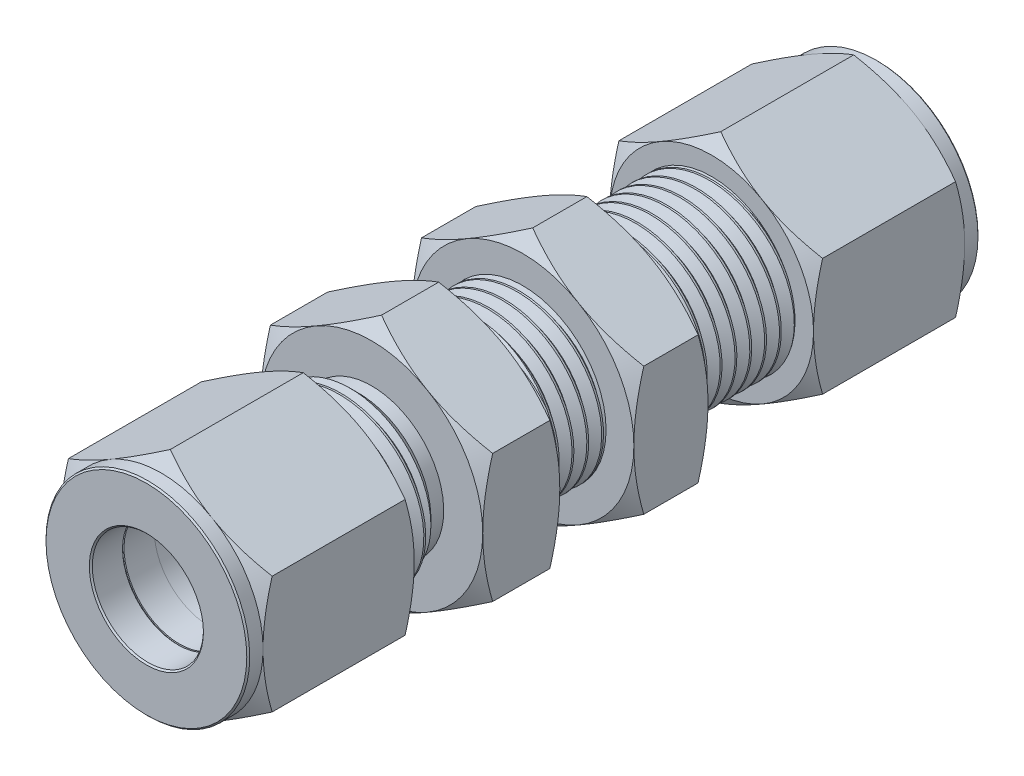
from build123d import *

# Parameters (mm, degrees)
BOSS_EXTRUDE1_DEPTH = 14.224
CHAMFER1_SIZE       = 0.127
SKETCH4_W           = 47.8155
SKETCH4_H           = 7.14375
CUT_SWEEP1_PITCH    = 1.27
CUT_SWEEP1_FROM     = 0
BOSS_EXTRUDE2_DEPTH = 6.604
CIRPATTERN1_COUNT   = 2
SKETCH11_R          = 7.14375
BOSS_EXTRUDE3_DEPTH = 6.35


with BuildPart() as part:
    # Sketch2 → Boss-Extrude1 (new body)
    with BuildSketch(Plane.XY):
        Polygon((0, 10.081979076), (-8.73125, 5.040989538), (-8.73125, -5.040989538), (0, -10.081979076), (8.73125, -5.040989538), (8.73125, 5.040989538), align=None)
    extrude(amount=-BOSS_EXTRUDE1_DEPTH)

    # Sketch3 → Cut-Revolve1 (revolve, cut)
    with BuildSketch(Plane(origin=(0, 0, 0), x_dir=(0, 0, -1), z_dir=(1, 0, 0)), mode=Mode.PRIVATE) as cut_revolve1_sk:
        Polygon((0, 10.081979076), (0, 8.73125), (1.27, 8.73125), (2.049843795, 10.081979076), (13.444156205, 10.081979076), (14.224, 8.73125), (14.224, 10.081979076), (14.224, 11.432708151), (0, 11.432708151), align=None)
        Polygon((0, 4.7625), (0, 0), (14.224, 0), (14.224, 7.14375), (5.6896, 7.14375), (5.6896, 6.50875), (2.8448, 6.50875), (2.8448, 5.87375), (2.8448, 4.7625), align=None)
    revolve(cut_revolve1_sk.sketch.rotate(Axis((0, 0, 0), (0, 0, -1)), 180), axis=Axis((0, 0, 0), (0, 0, -1)), mode=Mode.SUBTRACT)

    # Chamfer1
    chamfer1_edges = [part.edges().sort_by_distance(p)[0] for p in [
        (0, 8.73125, 0),
        (0, 4.7625, -2.8448),
        (0, 4.7625, 0),
    ]]
    chamfer(chamfer1_edges, length=CHAMFER1_SIZE)


with BuildPart() as body_2:
    # Sketch4 → Revolve1 (revolve)
    with BuildSketch(Plane(origin=(0, 0, 0), x_dir=(0, 0, -1), z_dir=(1, 0, 0))):
        with Locations((31.33725, 3.571875)):
            Rectangle(SKETCH4_W, SKETCH4_H)
    revolve(axis=Axis((0, 0, -55.245), (0, 0, 1)))

    # Cut-Sweep1: arcs per turn and ends read off the stored shape
    # Cut-Sweep1: the profile of Sketch6 screwed along a right-hand helix through 46.016197 turns, 8 arcs to a turn; built about Z, then put on its axis
    cut_sweep1_z = Axis((0, 0, 0), (0, 0, 1))
    cut_sweep1_corners = [(6.318860803, 0, -1.905), (7.212490766, 0, -2.4209375), (7.212490766, 0, -1.2303125), (6.318860803, 0, -1.74625)]
    with BuildLine(mode=Mode.PRIVATE) as cut_sweep1_profile:
        Line(cut_sweep1_corners[0], cut_sweep1_corners[1])
        Line(cut_sweep1_corners[1], cut_sweep1_corners[2])
        Line(cut_sweep1_corners[2], cut_sweep1_corners[3])
        Line(cut_sweep1_corners[3], cut_sweep1_corners[0])
    cut_sweep1_cap = Face(cut_sweep1_profile.wire())
    cut_sweep1_turn_angles = [0, 22.5, 45, 67.5, 90, 112.5, 135, 157.5, 180, 202.5, 225, 247.5, 270, 292.5, 315, 337.5, 360]
    cut_sweep1_turn_weights = [1, 0.9238795325112867, 1, 0.9238795325112867, 1, 0.9238795325112867, 1, 0.9238795325112867, 1, 0.9238795325112867, 1, 0.9238795325112867, 1, 0.9238795325112867, 1, 0.9238795325112867, 1]
    cut_sweep1_turn_rails = [Edge.make_bspline([Vector(p[0], p[1], 0).rotate(cut_sweep1_z, cut_sweep1_turn_angles[k]) / cut_sweep1_turn_weights[k] + Vector(0, 0, p[2] + CUT_SWEEP1_PITCH * cut_sweep1_turn_angles[k] / 360) for k in range(17)], [0, 0, 0, 1, 1, 2, 2, 3, 3, 4, 4, 5, 5, 6, 6, 7, 7, 8, 8, 8], 2, cut_sweep1_turn_weights) for p in cut_sweep1_corners]
    cut_sweep1_turn_sides = [Face.make_surface_from_curves(cut_sweep1_turn_rails[p[0]], cut_sweep1_turn_rails[p[1]]) for p in [(0, 1), (1, 2), (2, 3), (3, 0)]]
    cut_sweep1_last_angles = [16560, 16562.9155, 16565.831]
    cut_sweep1_last_weights = [1, 0.9987056339316177, 1]
    cut_sweep1_last_rails = [Edge.make_bspline([Vector(p[0], p[1], 0).rotate(cut_sweep1_z, cut_sweep1_last_angles[k]) / cut_sweep1_last_weights[k] + Vector(0, 0, p[2] + CUT_SWEEP1_PITCH * cut_sweep1_last_angles[k] / 360) for k in range(3)], [0, 0, 0, 1, 1, 1], 2, cut_sweep1_last_weights) for p in cut_sweep1_corners]
    cut_sweep1_last_sides = [Face.make_surface_from_curves(cut_sweep1_last_rails[p[0]], cut_sweep1_last_rails[p[1]]) for p in [(0, 1), (1, 2), (2, 3), (3, 0)]]
    cut_sweep1 = Plane(origin=(0, 0, -7.4295), x_dir=(0, 1, 0), z_dir=(0, 0, -1)) * split(Solid(Shell([*[p.moved(Location((0, 0, CUT_SWEEP1_PITCH * i))) for i in range(46) for p in cut_sweep1_turn_sides], *cut_sweep1_last_sides, cut_sweep1_cap, cut_sweep1_cap.rotate(cut_sweep1_z, 16565.831).moved(Location((0, 0, CUT_SWEEP1_PITCH * 16565.831 / 360)))])), bisect_by=Plane.XY.offset(CUT_SWEEP1_FROM), keep=Keep.TOP, mode=Mode.PRIVATE)
    add(cut_sweep1, mode=Mode.SUBTRACT)

    # Sketch7 → Boss-Extrude2 (add)
    with BuildSketch(Plane.XY.offset(-25.908)):
        Polygon((0, 10.998522628), (-9.525, 5.499261314), (-9.525, -5.499261314), (0, -10.998522628), (9.525, -5.499261314), (9.525, 5.499261314), align=None)
    extrude(amount=BOSS_EXTRUDE2_DEPTH)

    # Sketch8 → Cut-Revolve2 (revolve, cut)
    with BuildSketch(Plane(origin=(0, 0, 0), x_dir=(0, 0, -1), z_dir=(1, 0, 0)), mode=Mode.PRIVATE) as cut_revolve2_sk:
        Polygon((7.4295, 7.281231533), (7.4295, 6.18137927), (8.529352263, 7.281231533), align=None)
        Polygon((19.304, 7.281231533), (17.104295474, 7.281231533), (18.204147737, 6.18137927), (19.304, 6.18137927), align=None)
        Polygon((19.304, 9.525), (20.154738686, 10.998522628), (25.057261314, 10.998522628), (25.908, 9.525), (25.908, 10.998522628), (25.908, 12.472045256), (19.304, 12.472045256), (19.304, 10.998522628), align=None)
        Polygon((17.018, 3.5687), (45.6565, 3.5687), (45.6565, 4.7625), (51.751831579, 4.7625), (55.245, 5.626695313), (55.245, 0), (7.4295, 0), (7.4295, 5.626695312), (10.922668421, 4.7625), (17.018, 4.7625), align=None)
        Polygon((54.145147737, 7.281231533), (55.245, 7.281231533), (55.245, 6.18137927), align=None)
        Polygon((25.908, 6.18137927), (25.908, 7.281231533), (28.107704526, 7.281231533), (27.007852263, 6.18137927), align=None)
    revolve(cut_revolve2_sk.sketch.rotate(Axis((0, 0, 0), (0, 0, -1)), 90), axis=Axis((0, 0, 0), (0, 0, -1)), mode=Mode.SUBTRACT)


with BuildPart() as body_3:
    # Sketch9 → Revolve2 (revolve)
    with BuildSketch(Plane(origin=(0, 0, 0), x_dir=(0, 0, -1), z_dir=(1, 0, 0)), mode=Mode.PRIVATE) as revolve2_sk:
        Polygon((4.7625, 6.2865), (4.7625, 5.4356), (5.4356, 4.7625), (9.6393, 4.7625), (9.6393, 5.08), align=None)
    revolve(revolve2_sk.sketch.rotate(Axis((0, 0, 0), (0, 0, -1)), 90), axis=Axis((0, 0, 0), (0, 0, -1)))


with BuildPart() as body_4:
    # Sketch10 → Revolve3 (revolve)
    with BuildSketch(Plane(origin=(0, 0, 0), x_dir=(0, 0, -1), z_dir=(1, 0, 0)), mode=Mode.PRIVATE) as revolve3_sk:
        Polygon((2.8448, 6.223), (3.9878, 6.223), (3.9878, 5.4356), (4.7625, 5.4356), (5.4356, 4.7625), (2.8448, 4.7625), align=None)
    revolve(revolve3_sk.sketch.rotate(Axis((0, 0, 0), (0, 0, -1)), 90), axis=Axis((0, 0, 0), (0, 0, -1)))


with BuildPart() as cirpattern1_1:
    # CirPattern1: pattern copy
    add(body_3.part.rotate(Axis((0, 0, -31.33725), (1, 0, 0)), 1 * 360 / CIRPATTERN1_COUNT))


with BuildPart() as cirpattern1_2:
    # CirPattern1: pattern copy
    add(body_4.part.rotate(Axis((0, 0, -31.33725), (1, 0, 0)), 1 * 360 / CIRPATTERN1_COUNT))


with BuildPart() as cirpattern1_3:
    # CirPattern1: pattern copy
    add(part.part.rotate(Axis((0, 0, -31.33725), (1, 0, 0)), 1 * 360 / CIRPATTERN1_COUNT))


with BuildPart() as body_8:
    # Sketch11 → Boss-Extrude3 (new body)
    with BuildSketch(Plane.XY.offset(-32.258)):
        Polygon((0, 10.998522628), (-9.525, 5.499261314), (-9.525, -5.499261314), (0, -10.998522628), (9.525, -5.499261314), (9.525, 5.499261314), align=None)
        Circle(SKETCH11_R, mode=Mode.SUBTRACT)
    extrude(amount=-BOSS_EXTRUDE3_DEPTH)

    # Sketch12 → Cut-Revolve3 (revolve, cut)
    with BuildSketch(Plane(origin=(0, 0, 0), x_dir=(0, 0, -1), z_dir=(1, 0, 0)), mode=Mode.PRIVATE) as cut_revolve3_sk:
        Polygon((32.258, 9.525), (32.258, 10.998522628), (32.258, 12.472045256), (38.608, 12.472045256), (38.608, 10.998522628), (38.608, 9.525), (37.757261314, 10.998522628), (33.108738686, 10.998522628), align=None)
    revolve(cut_revolve3_sk.sketch.rotate(Axis((0, 0, 0), (0, 0, -1)), 180), axis=Axis((0, 0, 0), (0, 0, -1)), mode=Mode.SUBTRACT)


solid = Compound([part.part, body_2.part, body_3.part, body_4.part, cirpattern1_1.part, cirpattern1_2.part, cirpattern1_3.part, body_8.part])
